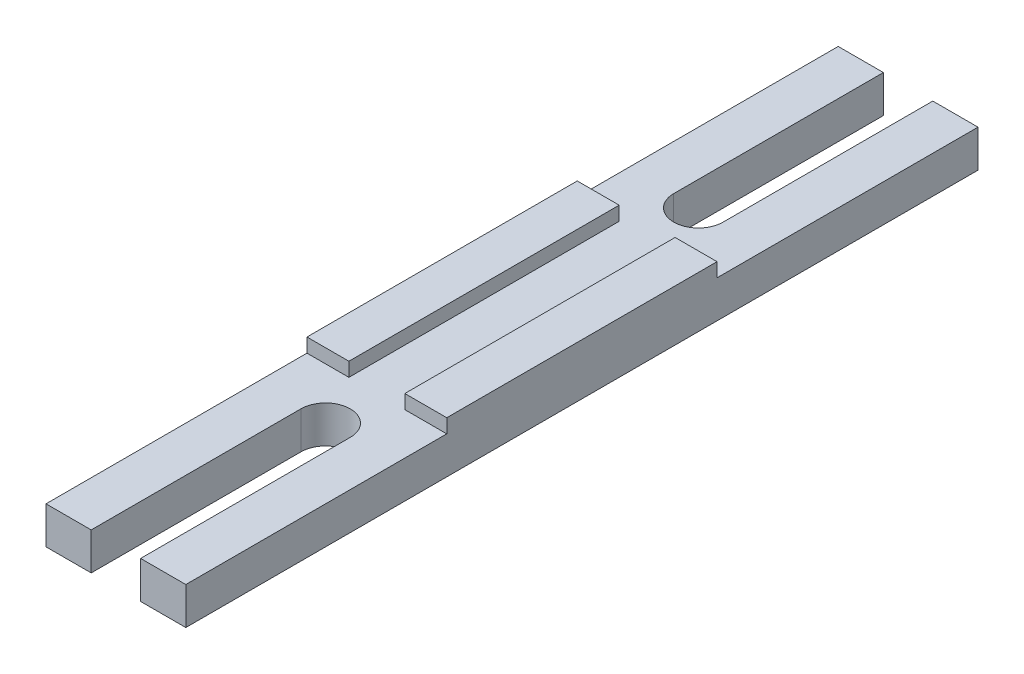
from build123d import *

# Parameters (mm, degrees)
BOSS_EXTRUDE1_DEPTH    = 3.175
SKETCH2_W              = 15
SKETCH2_H              = 55
BOSS_EXTRUDE2_DEPTH    = 5.5
CUT_EXTRUDE1_DEPTH     = 47.569840025
FILLET1_R              = 20
SKETCH6_W              = 31.616763165
SKETCH6_H              = 17.5
CUT_EXTRUDE3_DEPTH     = 50.489449633
BOSS_EXTRUDE4_DEPTH    = 3
FILLET3_R              = 5
SKETCH9_W              = 13
SKETCH9_H              = 1.5
CUT_EXTRUDE4_DEPTH     = 51.855333187
SPLIT1_SURFACE_1_BACK  = 62.685
SPLIT1_SURFACE_1_DEPTH = 125.37
SPLIT1_SURFACE_2_BACK  = 62.685
SPLIT1_SURFACE_2_DEPTH = 125.37
SKETCH12_W             = 4.85
SKETCH12_H             = 15
BOSS_EXTRUDE5_DEPTH    = 4


with BuildPart() as part:
    # Sketch1 → Boss-Extrude1 (new, symmetric)
    with BuildSketch(Plane(origin=(0, 0, 0), x_dir=(0, 0, -1), z_dir=(1, 0, 0))):
        Polygon((0, 0), (0, 23), (20, 23), (30, 6), (30, 0), align=None)
    extrude(amount=BOSS_EXTRUDE1_DEPTH, both=True)

    # Sketch2 → Boss-Extrude2 (add)
    with BuildSketch(Plane.XZ):
        with Locations((0, -15)):
            Rectangle(SKETCH2_W, SKETCH2_H)
    extrude(amount=-BOSS_EXTRUDE2_DEPTH)

    # Sketch3 → Cut-Extrude1 (cut, through all)
    with BuildSketch(Plane(origin=(0, 5.5, 0), x_dir=(1, 0, 0), z_dir=(0, 1, 0))):
        with BuildLine():
            Line((2.65, 45), (2.65, 35))
            ThreePointArc((2.65, 35), (0, 32.35), (-2.65, 35))
            Line((-2.65, 35), (-2.65, 45))
            ThreePointArc((-2.65, 45), (0, 47.65), (2.65, 45))
        make_face()
        with BuildLine():
            Line((2.65, -15), (2.65, -5))
            ThreePointArc((2.65, -5), (0, -2.35), (-2.65, -5))
            Line((-2.65, -5), (-2.65, -15))
            ThreePointArc((-2.65, -15), (0, -17.65), (2.65, -15))
        make_face()
    extrude(amount=-CUT_EXTRUDE1_DEPTH, mode=Mode.SUBTRACT)

    # Fillet1
    fillet1_edges = [part.edges().sort_by_distance(p)[0] for p in [
        (0, 23, -20),
    ]]
    fillet(fillet1_edges, radius=FILLET1_R)

    # Sketch6 → Cut-Extrude3 (cut, through all)
    with BuildSketch(Plane(origin=(3.175, 0, 0), x_dir=(0, 0, -1), z_dir=(1, 0, 0))):
        with Locations((15.808381583, 14.25)):
            Rectangle(SKETCH6_W, SKETCH6_H)
    extrude(amount=-CUT_EXTRUDE3_DEPTH, mode=Mode.SUBTRACT)

    # Sketch7 → Boss-Extrude4 (add, symmetric)
    with BuildSketch(Plane(origin=(0, 0, 0), x_dir=(0, 0, -1), z_dir=(1, 0, 0))):
        Polygon((0.5, 5.5), (0.5, 15.105993457), (24.253814646, 15.105993457), (24.253814646, 23.558754498), (33.902459411, 23.558754498), (33.902459411, 12.772125994), (29.5, 12.772125994), (29.5, 5.5), (15, 5.5), align=None)
    extrude(amount=BOSS_EXTRUDE4_DEPTH, both=True)

    # Fillet3
    # the kernel refuses this fillet: 5 mm, written as the material it adds along each edge
    with BuildSketch(Plane(origin=(3, 12.772125994, -29.5), x_dir=(0, -1, 0), z_dir=(-1, 0, 0))) as fillet3_piece_1:
        with BuildLine():
            CenterArc((4.964166118, -5), FILLET3_R, 90, 83.136284475)
            Line((0, -4.402459411), (0, 0))
            Line((0, 0), (4.964166118, 0))
        make_face()
    extrude(amount=6)
    with BuildSketch(Plane(origin=(3, 15.105993457, -24.253814646), x_dir=(0, 0, 1), z_dir=(-1, 0, 0))) as fillet3_piece_2:
        with BuildLine():
            CenterArc((FILLET3_R, FILLET3_R), FILLET3_R, 180, 90)
            Line((0, FILLET3_R), (0, 0))
            Line((0, 0), (FILLET3_R, 0))
        make_face()
    extrude(amount=6)
    # the kernel refuses this fillet: 5 mm, written as the material it takes off along each edge
    with BuildSketch(Plane(origin=(15.5, 15.105993457, -0.5), x_dir=(0, -1, 0), z_dir=(-1, 0, 0))) as fillet3_2_piece_1:
        with BuildLine():
            CenterArc((FILLET3_R, -FILLET3_R), FILLET3_R, 90, 90)
            Line((0, -FILLET3_R), (0, 0))
            Line((0, 0), (FILLET3_R, 0))
        make_face()
    extrude(amount=31, mode=Mode.SUBTRACT)

    # Sketch9 → Cut-Extrude4 (cut, through all)
    with BuildSketch(Plane(origin=(7.5, 0, 0), x_dir=(0, 0, -1), z_dir=(1, 0, 0))):
        with Locations((-6, 4.75)):
            Rectangle(SKETCH9_W, SKETCH9_H)
        with Locations((36, 4.75)):
            Rectangle(SKETCH9_W, SKETCH9_H)
    extrude(amount=-CUT_EXTRUDE4_DEPTH, mode=Mode.SUBTRACT)


with BuildPart() as body_2:
    # Split1: the piece behind the surface
    add(part.part)
    # Split1 surface: a surface, the sketch's curves swept straight by 125.37 mm
    with BuildLine(Plane(origin=(0, 0, -29.5), x_dir=(-1, 0, 0), z_dir=(0, 0, -1)).offset(-SPLIT1_SURFACE_1_BACK), mode=Mode.PRIVATE) as split1_surface_1_path:
        Line((-3, 7.807959877), (-3, 4))
        Line((-3, 4), (3, 4))
        Line((3, 4), (3, 7.807959877))
    split1_surface_1 = Shell.extrude(split1_surface_1_path.wire(), (0 * SPLIT1_SURFACE_1_DEPTH, 0 * SPLIT1_SURFACE_1_DEPTH, -1 * SPLIT1_SURFACE_1_DEPTH))
    split(bisect_by=split1_surface_1, keep=Keep.BOTTOM)

    # Sketch12 → Boss-Extrude5 (add)
    with BuildSketch(Plane(origin=(0, 4, 0), x_dir=(1, 0, 0), z_dir=(0, 1, 0))):
        with Locations((-5.075, 50)):
            Rectangle(SKETCH12_W, SKETCH12_H)
        with Locations((5.075, 50)):
            Rectangle(SKETCH12_W, SKETCH12_H)
        with Locations((-5.075, -20)):
            Rectangle(SKETCH12_W, SKETCH12_H)
        with Locations((5.075, -20)):
            Rectangle(SKETCH12_W, SKETCH12_H)
    extrude(amount=-BOSS_EXTRUDE5_DEPTH)


with BuildPart() as part_1:
    add(part.part)

    # Split1: split by a surface, the side it looks to stays
    # Split1 surface: a surface, the sketch's curves swept straight by 125.37 mm
    with BuildLine(Plane(origin=(0, 0, -29.5), x_dir=(-1, 0, 0), z_dir=(0, 0, -1)).offset(-SPLIT1_SURFACE_2_BACK), mode=Mode.PRIVATE) as split1_surface_2_path:
        Line((-3, 7.807959877), (-3, 4))
        Line((-3, 4), (3, 4))
        Line((3, 4), (3, 7.807959877))
    split1_surface_2 = Shell.extrude(split1_surface_2_path.wire(), (0 * SPLIT1_SURFACE_2_DEPTH, 0 * SPLIT1_SURFACE_2_DEPTH, -1 * SPLIT1_SURFACE_2_DEPTH))
    split(bisect_by=split1_surface_2, keep=Keep.TOP)


solid = body_2.part
